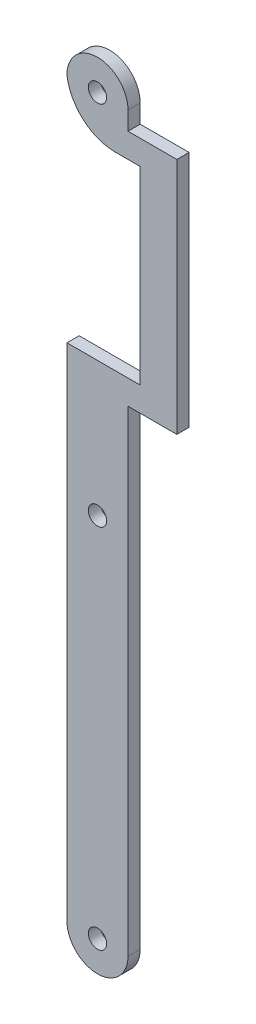
from build123d import *

# Parameters (mm, degrees)
SKETCH_1_R          = 1.5
EXTRUDE_1_DEPTH     = 2
SKETCH_2_W          = 2
SKETCH_2_H          = 4
EXTRUDE_5_DEPTH     = 18
SKETCH_5_W          = 3
SKETCH_5_H          = 2
EXTRUDE_6_DEPTH     = 35
SKETCH_7_W          = 2
SKETCH_7_H          = 4
EXTRUDE_9_DEPTH     = 8
SKETCH_9_W          = 10
SKETCH_9_H          = 31
CUT_EXTRUDE_2_DEPTH = 15
SKETCH_10_W         = 3
SKETCH_10_H         = 31
EXTRUDE_10_DEPTH    = 2
FILLET_1_R          = 8


with BuildPart() as part:
    # 草图1 → 凸台-拉伸1 (new body)
    with BuildSketch(Plane.XY):
        with BuildLine():
            Line((5, 60), (5, -60))
            ThreePointArc((5, -60), (0, -65), (-5, -60))
            Line((-5, -60), (-5, 60))
            ThreePointArc((-5, 60), (0, 65), (5, 60))
        make_face()
        with Locations((0, 60)):
            Circle(SKETCH_1_R, mode=Mode.SUBTRACT)
        with Locations(Location((0, -60, 0), (0, 0, 180))):
            Circle(SKETCH_1_R, mode=Mode.SUBTRACT)
        Circle(SKETCH_1_R, mode=Mode.SUBTRACT)
    extrude(amount=EXTRUDE_1_DEPTH)

    # 草图2 → 凸台-拉伸5 (add)
    with BuildSketch(Plane.ZY.offset(5)):
        with Locations((1, 55)):
            Rectangle(SKETCH_2_W, SKETCH_2_H)
    extrude(amount=-EXTRUDE_5_DEPTH)

    # 草图5 → 凸台-拉伸6 (add)
    with BuildSketch(Plane.XZ.offset(-53)):
        with Locations((11.5, 1)):
            Rectangle(SKETCH_5_W, SKETCH_5_H)
    extrude(amount=EXTRUDE_6_DEPTH)

    # 草图7 → 凸台-拉伸9 (add)
    with BuildSketch(Plane(origin=(13, 0, 0), x_dir=(0, 0, -1), z_dir=(1, 0, 0))):
        with Locations((-1, 20)):
            Rectangle(SKETCH_7_W, SKETCH_7_H)
    extrude(amount=-EXTRUDE_9_DEPTH)

    # 草图9 → 切除-拉伸2 (cut)
    with BuildSketch(Plane(origin=(0, 0, 0), x_dir=(-1, 0, 0), z_dir=(0, 0, -1))):
        with Locations((0, 37.5)):
            Rectangle(SKETCH_9_W, SKETCH_9_H)
    extrude(amount=-CUT_EXTRUDE_2_DEPTH, mode=Mode.SUBTRACT)

    # 草图10 → 凸台-拉伸10 (add)
    with BuildSketch(Plane(origin=(0, 0, 0), x_dir=(-1, 0, 0), z_dir=(0, 0, -1))):
        with Locations((-8.5, 37.5)):
            Rectangle(SKETCH_10_W, SKETCH_10_H)
    extrude(amount=-EXTRUDE_10_DEPTH)

    # 圆角1
    # the kernel refuses this fillet: 8 mm, written as the material it takes off along each edge
    with BuildSketch(Plane(origin=(-5, 53, -19.843134833), x_dir=(1, 0, 0), z_dir=(0, 0, 1))) as fillet_1_piece_1:
        with BuildLine():
            CenterArc((7.937253933, 8), FILLET_1_R, 187.180755781, 82.819244219)
            Line((0, 7), (0, 0))
            Line((0, 0), (7.937253933, 0))
        make_face()
    extrude(amount=41.686269666, mode=Mode.SUBTRACT)


solid = part.part
